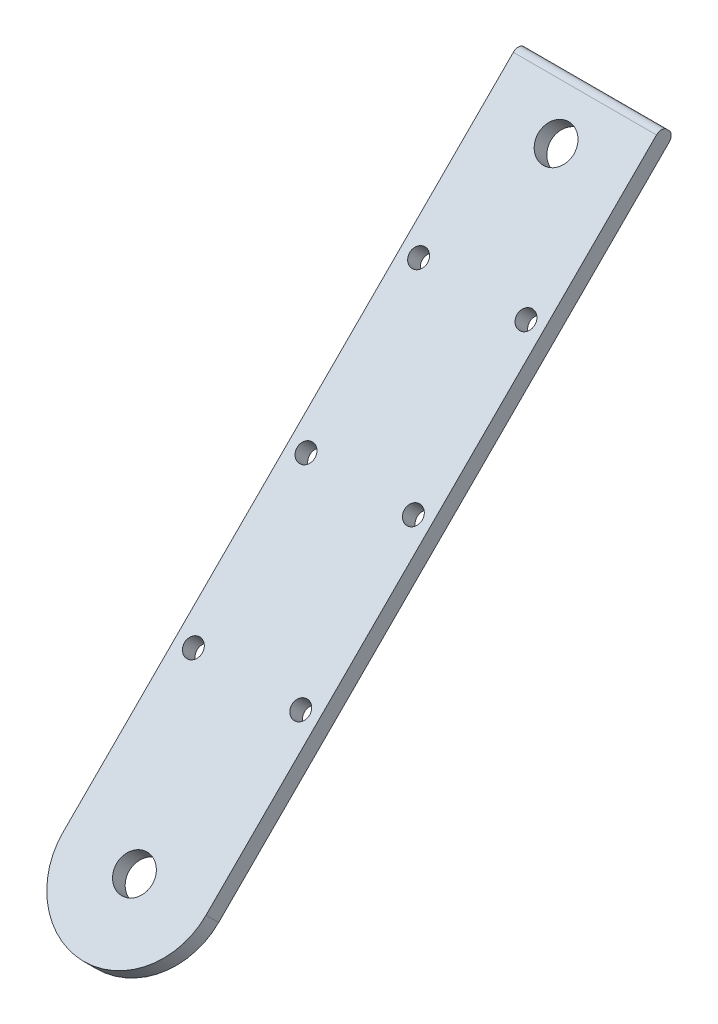
from build123d import *

# Parameters (mm, degrees)
BOSS_EXTRUDE1_DEPTH = 40
FILLET3_R           = 20
FILLET4_R           = 20
SKETCH2_R           = 5
SKETCH2_R_2         = 2.5
CUT_EXTRUDE1_DEPTH  = 5
SKETCH3_R           = 5
CUT_EXTRUDE2_DEPTH  = 5


with BuildPart() as part:
    # Sketch1 → Boss-Extrude1 (new body)
    with BuildSketch(Plane(origin=(0, 0, 0), x_dir=(0, 0, -1), z_dir=(1, 0, 0))):
        with BuildLine():
            Line((-58.598472687, -15.960552102), (-57.184259125, -14.54633854))
            Line((-57.184259125, -14.54633854), (-34.253623627, 8.384296958))
            Line((-34.253623627, 8.384296958), (81.408669988, 124.046590573))
            ThreePointArc((81.408669988, 124.046590573), (81.994456425, 125.460804135), (81.408669988, 126.875017697))
            Line((81.408669988, 126.875017697), (80.703876553, 127.579811132))
            ThreePointArc((80.703876553, 127.579811132), (79.289662991, 128.165597569), (77.875449429, 127.579811132))
            Line((77.875449429, 127.579811132), (-37.786844186, 11.917517517))
            Line((-37.786844186, 11.917517517), (-60.717479684, -11.013117981))
            Line((-60.717479684, -11.013117981), (-62.131693246, -12.427331543))
            Line((-62.131693246, -12.427331543), (-60.717479684, -13.841545106))
            Line((-60.717479684, -13.841545106), (-60.01268625, -14.54633854))
            Line((-60.01268625, -14.54633854), (-58.598472687, -15.960552102))
        make_face()
    extrude(amount=BOSS_EXTRUDE1_DEPTH)

    # Fillet3
    fillet3_edges = [part.edges().sort_by_distance(p)[0] for p in [
        (40, -14.193941823, 60.365082967),
    ]]
    fillet(fillet3_edges, radius=FILLET3_R)

    # Fillet4
    fillet4_edges = [part.edges().sort_by_distance(p)[0] for p in [
        (0, -14.193941823, 60.365082967),
    ]]
    fillet(fillet4_edges, radius=FILLET4_R - 0.0001)  # a hair under: the kernel refuses the full size

    # Sketch2 → Cut-Extrude1 (cut)
    with BuildSketch(Plane(origin=(0, 24.852180852, 24.852180852), x_dir=(1, 0, 0), z_dir=(0, 0.7071067811865465, 0.7071067811865487))):
        with Locations(Location((20, -32.721192027, 0), (0, 0, 270))):
            Circle(SKETCH2_R)
        with Locations(Location((35, 100.778807973, 0), (0, 0, 270))):
            Circle(SKETCH2_R_2)
        with Locations(Location((35, 56.278807973, 0), (0, 0, 270))):
            Circle(SKETCH2_R_2)
        with Locations(Location((35, 11.778807973, 0), (0, 0, 270))):
            Circle(SKETCH2_R_2)
        with Locations(Location((5, 11.778807973, 0), (0, 0, 90))):
            Circle(SKETCH2_R_2)
        with Locations(Location((5, 56.278807973, 0), (0, 0, 90))):
            Circle(SKETCH2_R_2)
        with Locations(Location((5, 100.778807973, 0), (0, 0, 90))):
            Circle(SKETCH2_R_2)
    extrude(amount=-CUT_EXTRUDE1_DEPTH, mode=Mode.SUBTRACT)

    # Sketch3 → Cut-Extrude2 (cut)
    with BuildSketch(Plane(origin=(0, 21.318960292, 21.318960292), x_dir=(1, 0, 0), z_dir=(0, -0.7071067811865434, -0.7071067811865518))):
        with Locations(Location((20, -133.888702436, 0), (0, 0, 270))):
            Circle(SKETCH3_R)
    extrude(amount=-CUT_EXTRUDE2_DEPTH, mode=Mode.SUBTRACT)


solid = part.part
